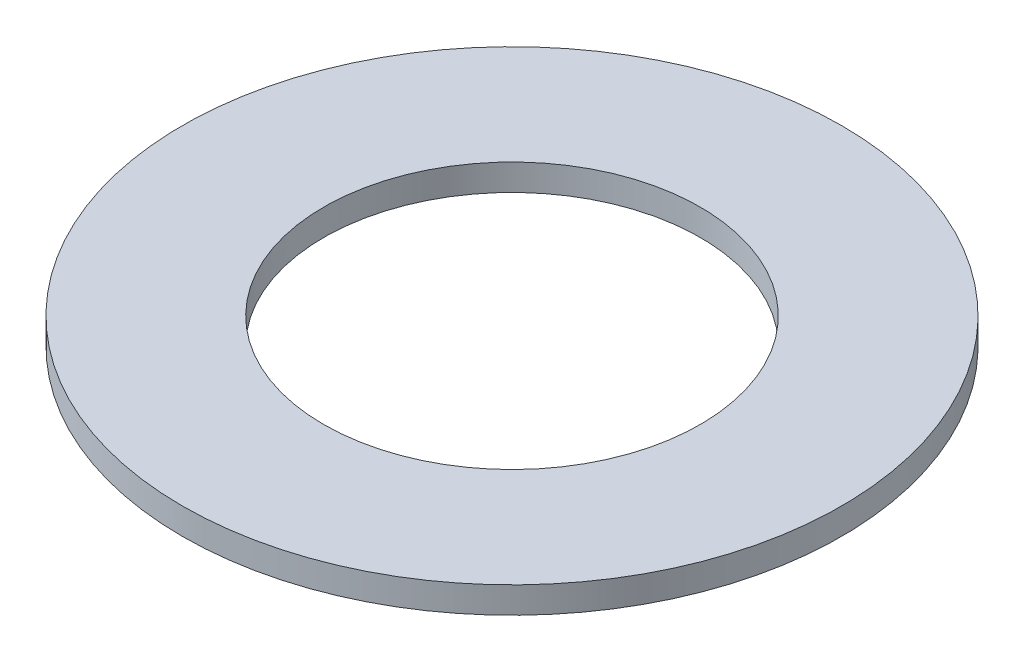
from build123d import *

# Parameters (mm, degrees)
SKETCH1_R           = 87.5
BOSS_EXTRUDE1_DEPTH = 7
SKETCH2_R           = 50
CUT_EXTRUDE1_DEPTH  = 124.941518467


with BuildPart() as part:
    # Sketch1 → Boss-Extrude1 (new body)
    with BuildSketch(Plane(origin=(0, 0, 0), x_dir=(1, 0, 0), z_dir=(0, 1, 0))):
        Circle(SKETCH1_R)
    extrude(amount=BOSS_EXTRUDE1_DEPTH)

    # Sketch2 → Cut-Extrude1 (cut, through all)
    with BuildSketch(Plane(origin=(0, 0, 0), x_dir=(1, 0, 0), z_dir=(0, 1, 0))):
        Circle(SKETCH2_R)
    extrude(amount=CUT_EXTRUDE1_DEPTH, mode=Mode.SUBTRACT)


solid = part.part
